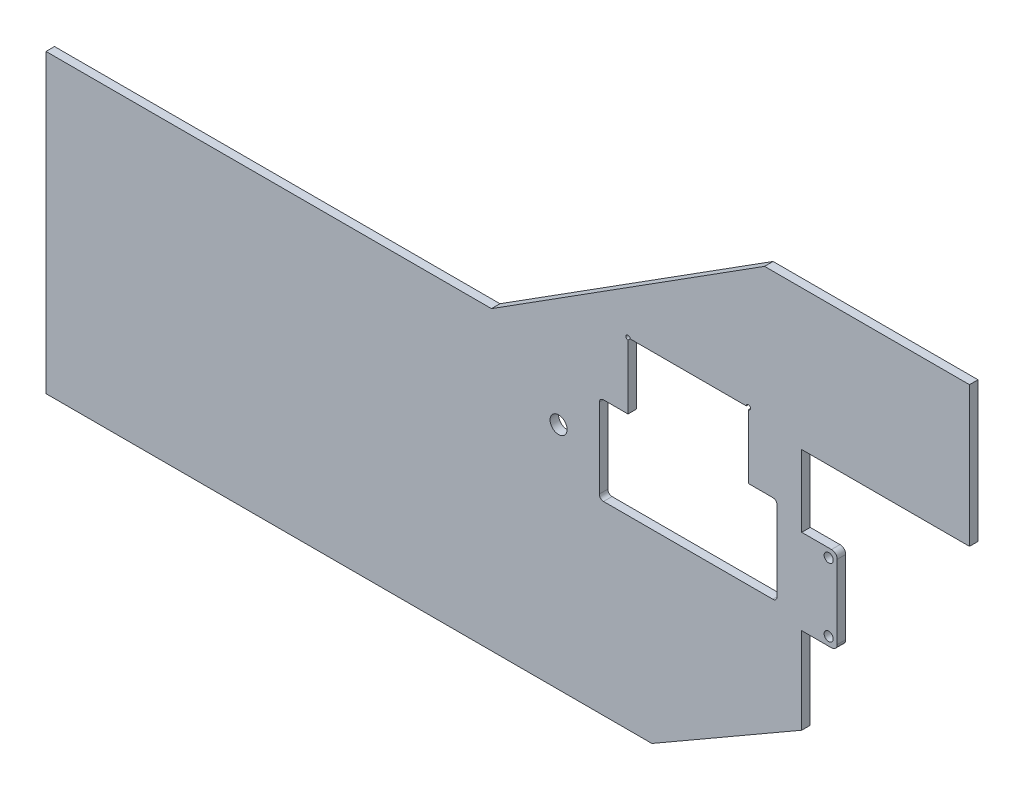
from build123d import *

# Parameters (mm, degrees)
SKETCH1_W           = 163.178820173
SKETCH1_H           = 83.61431582
BOSS_EXTRUDE1_DEPTH = 3
SKETCH2_R           = 3
CUT_EXTRUDE1_DEPTH  = 70
SKETCH3_R           = 1.6
BOSS_EXTRUDE2_DEPTH = 3
CUT_EXTRUDE2_DEPTH  = 10


with BuildPart() as part:
    # Sketch1 → Boss-Extrude1 (new body)
    with BuildSketch(Plane.XY):
        with Locations((-102.048100406, 5.79284209)):
            Rectangle(SKETCH1_W, SKETCH1_H)
    extrude(amount=BOSS_EXTRUDE1_DEPTH)

    # Sketch2 → Cut-Extrude1 (cut)
    with BuildSketch(Plane.XY.offset(3)):
        with Locations((-24.288671568, 24)):
            Circle(SKETCH2_R)
    extrude(amount=-CUT_EXTRUDE1_DEPTH, mode=Mode.SUBTRACT)

    # Sketch3 → Boss-Extrude2 (add)
    with BuildSketch(Plane.XY.offset(3)):
        with BuildLine():
            Line((-20.45869032, -36.01431582), (-20.45869032, 47.6))
            Line((-20.45869032, 47.6), (-47.930221969, 47.6))
            Line((-47.930221969, 47.6), (48.280810352, 108.603325903))
            Line((48.280810352, 108.603325903), (120.475395506, 108.603325903))
            Line((120.475395506, 108.603325903), (120.475395506, 59.260158943))
            Line((120.475395506, 59.260158943), (61.371328432, 59.260158943))
            Line((61.371328432, 59.260158943), (61.371328432, 34))
            Line((61.371328432, 34), (71.871328432, 34))
            ThreePointArc((71.871328432, 34), (73.285541995, 33.414213562), (73.871328432, 32))
            Line((73.871328432, 32), (73.871328432, 6))
            ThreePointArc((73.871328432, 6), (73.285541995, 4.585786438), (71.871328432, 4))
            Line((71.871328432, 4), (61.371328432, 4))
            Line((61.371328432, 4), (61.371328432, -26.386498553))
            Line((61.371328432, -26.386498553), (8.585459344, -56.821879063))
            Line((8.585459344, -56.821879063), (-204.873017797, -56.821879063))
            Line((-204.873017797, -56.821879063), (-204.873017797, 47.6))
            Line((-204.873017797, 47.6), (-183.637510493, 47.6))
            Line((-183.637510493, 47.6), (-183.637510493, -36.01431582))
            Line((-183.637510493, -36.01431582), (-20.45869032, -36.01431582))
        make_face()
        with Locations((70.871328432, 31)):
            Circle(SKETCH3_R, mode=Mode.SUBTRACT)
        with Locations((70.871328432, 7)):
            Circle(SKETCH3_R, mode=Mode.SUBTRACT)
    extrude(amount=-BOSS_EXTRUDE2_DEPTH)

    # Sketch4 → Cut-Extrude2 (cut)
    with BuildSketch(Plane.XY.offset(3)):
        with BuildLine():
            Line((0.171328432, 62.05), (0.171328432, 39.5))
            Line((0.171328432, 39.5), (-8.45869032, 39.5))
            ThreePointArc((-8.45869032, 39.5), (-9.519350491, 39.060660172), (-9.95869032, 38))
            Line((-9.95869032, 38), (-9.95869032, 10))
            ThreePointArc((-9.95869032, 10), (-9.519350491, 8.939339828), (-8.45869032, 8.5))
            Line((-8.45869032, 8.5), (51.201347185, 8.5))
            ThreePointArc((51.201347185, 8.5), (52.262007356, 8.939339828), (52.701347185, 10))
            Line((52.701347185, 10), (52.701347185, 38))
            ThreePointArc((52.701347185, 38), (52.262007356, 39.060660172), (51.201347185, 39.5))
            Line((51.201347185, 39.5), (42.571328432, 39.5))
            Line((42.571328432, 39.5), (42.571328432, 62.05))
            ThreePointArc((42.571328432, 62.05), (43.101658518, 63.330330086), (41.821328432, 62.8))
            Line((41.821328432, 62.8), (0.921328432, 62.8))
            ThreePointArc((0.921328432, 62.8), (-0.359001653, 63.330330086), (0.171328432, 62.05))
        make_face()
    extrude(amount=-CUT_EXTRUDE2_DEPTH, mode=Mode.SUBTRACT)


solid = part.part
